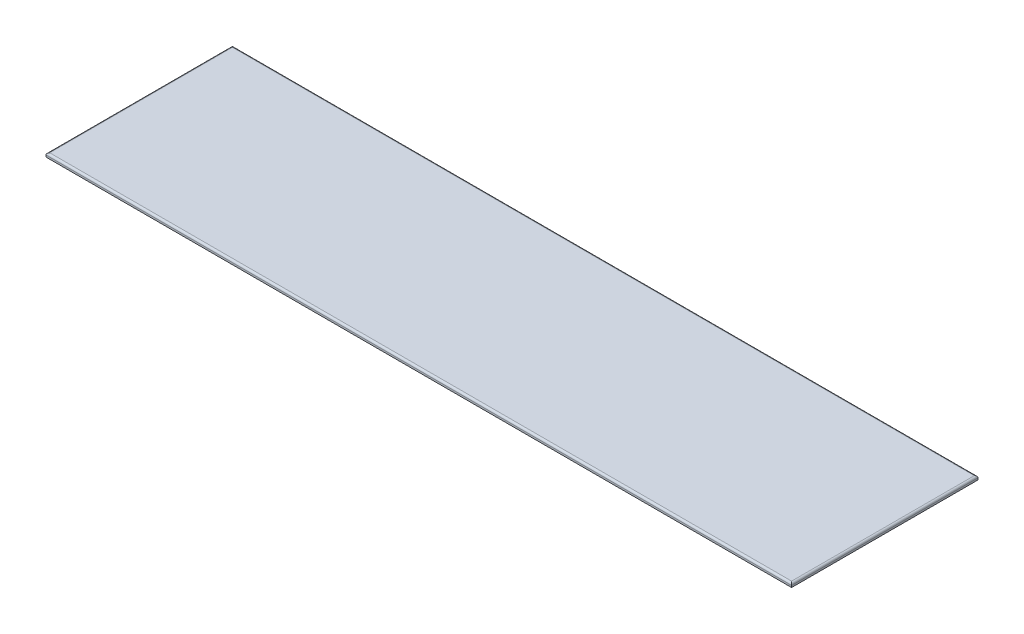
from build123d import *

# Parameters (mm, degrees)
SKETCH_1_W             = 200
SKETCH_1_H             = 50
SM_BASE_FLANGE_1_DEPTH = 1
FILLET_1_R             = 0.5


# Sheet-metal steps are written as plain solids
with BuildPart() as part:
    # Sketch 1 → 基体-法兰1 (new body)
    with BuildSketch(Plane(origin=(0, 0, 0), x_dir=(1, 0, 0), z_dir=(0, 1, 0))):
        with Locations((100, 25)):
            Rectangle(SKETCH_1_W, SKETCH_1_H)
    extrude(amount=-SM_BASE_FLANGE_1_DEPTH)

    # 圆角1
    fillet_1_edges = [part.edges().sort_by_distance(p)[0] for p in [
        (100, 0, -50),
        (200, 0, -25),
        (100, 0, 0),
        (0, 0, -25),
    ]]
    fillet(fillet_1_edges, radius=FILLET_1_R)


solid = part.part
